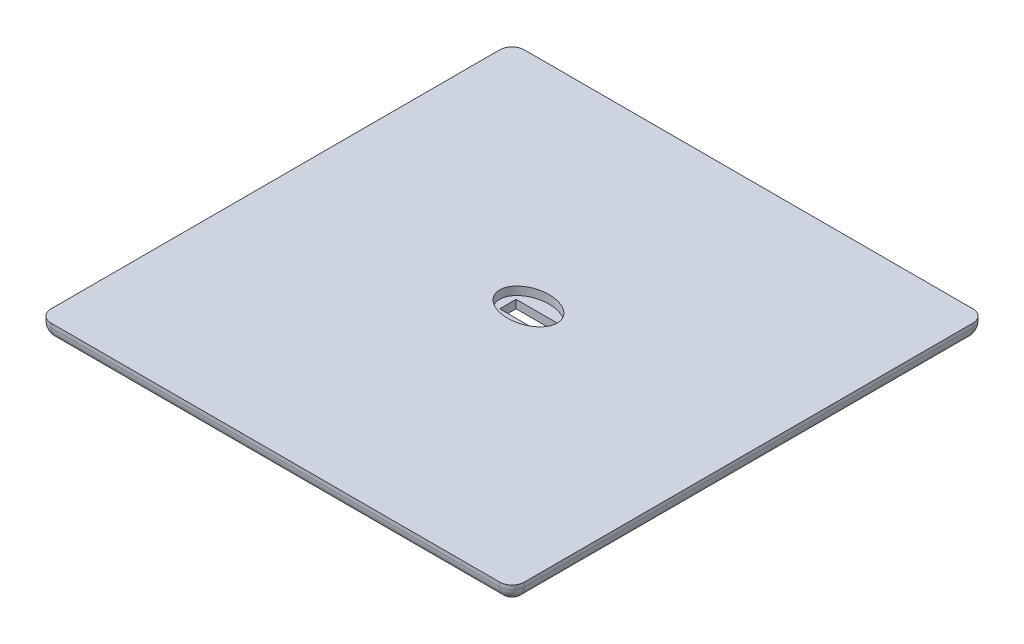
from build123d import *

# Parameters (mm, degrees)
BOSS_EXTRUDE4_DEPTH      = 47.5
BOSS_EXTRUDE4_DEPTH_BACK = 47.5
SKETCH7_W                = 95
SKETCH7_H                = 4
BOSS_EXTRUDE5_DEPTH      = 52.5
BOSS_EXTRUDE5_DEPTH_BACK = 52.5
SKETCH8_W                = 105
SKETCH8_H                = 4
BOSS_EXTRUDE6_DEPTH      = 57.5
BOSS_EXTRUDE6_DEPTH_BACK = 57.5
SKETCH9_W                = 115
SKETCH9_H                = 4
CUT_EXTRUDE1_DEPTH       = 8
CUT_EXTRUDE1_DEPTH_BACK  = 3.5
SKETCH10_W               = 85
SKETCH10_H               = 85
SKETCH12_RX              = 7
SKETCH12_RY              = 5
CUT_EXTRUDE2_DEPTH       = 2
CUT_EXTRUDE3_DEPTH       = 29
CUT_EXTRUDE3_DEPTH_BACK  = 83.197931847
SKETCH13_W               = 10
SKETCH13_H               = 4
FILLET4_R                = 3


with BuildPart() as part:
    # Sketch7 → Boss-Extrude4 (new, two sides: drawn at the far end of the back side and taken through both)
    with BuildSketch(Plane.XY.offset(-BOSS_EXTRUDE4_DEPTH_BACK)):
        with Locations((0, 2)):
            Rectangle(SKETCH7_W, SKETCH7_H)
    extrude(amount=BOSS_EXTRUDE4_DEPTH + BOSS_EXTRUDE4_DEPTH_BACK)

    # Sketch8 → Boss-Extrude5 (add, two sides: drawn at the far end of the back side and taken through both)
    with BuildSketch(Plane.XY.offset(-BOSS_EXTRUDE5_DEPTH_BACK)):
        with Locations((0, 6)):
            Rectangle(SKETCH8_W, SKETCH8_H)
    extrude(amount=BOSS_EXTRUDE5_DEPTH + BOSS_EXTRUDE5_DEPTH_BACK)

    # Sketch9 → Boss-Extrude6 (add, two sides: drawn at the far end of the back side and taken through both)
    with BuildSketch(Plane.XY.offset(-BOSS_EXTRUDE6_DEPTH_BACK)):
        with Locations((0, 10)):
            Rectangle(SKETCH9_W, SKETCH9_H)
    extrude(amount=BOSS_EXTRUDE6_DEPTH + BOSS_EXTRUDE6_DEPTH_BACK)

    # Sketch10 → Cut-Extrude1 (cut, two sides: drawn at the far end of the back side and taken through both)
    with BuildSketch(Plane(origin=(0, 0, 0), x_dir=(1, 0, 0), z_dir=(0, 1, 0)).offset(-CUT_EXTRUDE1_DEPTH_BACK)):
        Rectangle(SKETCH10_W, SKETCH10_H)
    extrude(amount=CUT_EXTRUDE1_DEPTH + CUT_EXTRUDE1_DEPTH_BACK, mode=Mode.SUBTRACT)

    # Sketch12 → Cut-Extrude2 (cut)
    with BuildSketch(Plane(origin=(0, 12, 0), x_dir=(1, 0, 0), z_dir=(0, 1, 0))):
        with Locations((0, 4)):
            Ellipse(SKETCH12_RX, SKETCH12_RY)
    extrude(amount=-CUT_EXTRUDE2_DEPTH, mode=Mode.SUBTRACT)

    # Sketch13 → Cut-Extrude3 (cut, two sides: drawn at the far end of the back side and taken through both)
    with BuildSketch(Plane(origin=(0, 0, 0), x_dir=(1, 0, 0), z_dir=(0, 1, 0)).offset(-CUT_EXTRUDE3_DEPTH_BACK)):
        with Locations((0, 4)):
            Rectangle(SKETCH13_W, SKETCH13_H)
    extrude(amount=CUT_EXTRUDE3_DEPTH + CUT_EXTRUDE3_DEPTH_BACK, mode=Mode.SUBTRACT)

    # Fillet4
    fillet4_edges = [part.edges().sort_by_distance(p)[0] for p in [
        (-47.5, 2, -47.5),
        (-52.5, 6, -52.5),
        (-57.5, 10, -57.5),
        (-47.5, 0, 0),
        (-52.5, 4, 0),
        (-57.5, 8, 0),
        (-57.5, 10, 57.5),
        (-52.5, 6, 52.5),
        (-47.5, 2, 47.5),
        (0, 8, -57.5),
        (0, 4, -52.5),
        (0, 0, -47.5),
        (47.5, 2, -47.5),
        (52.5, 6, -52.5),
        (57.5, 10, -57.5),
        (57.5, 10, 57.5),
        (0, 8, 57.5),
        (57.5, 8, 0),
        (52.5, 4, 0),
        (0, 4, 52.5),
        (52.5, 6, 52.5),
        (47.5, 2, 47.5),
        (47.5, 0, 0),
        (0, 0, 47.5),
    ]]
    fillet(fillet4_edges, radius=FILLET4_R)


solid = part.part
